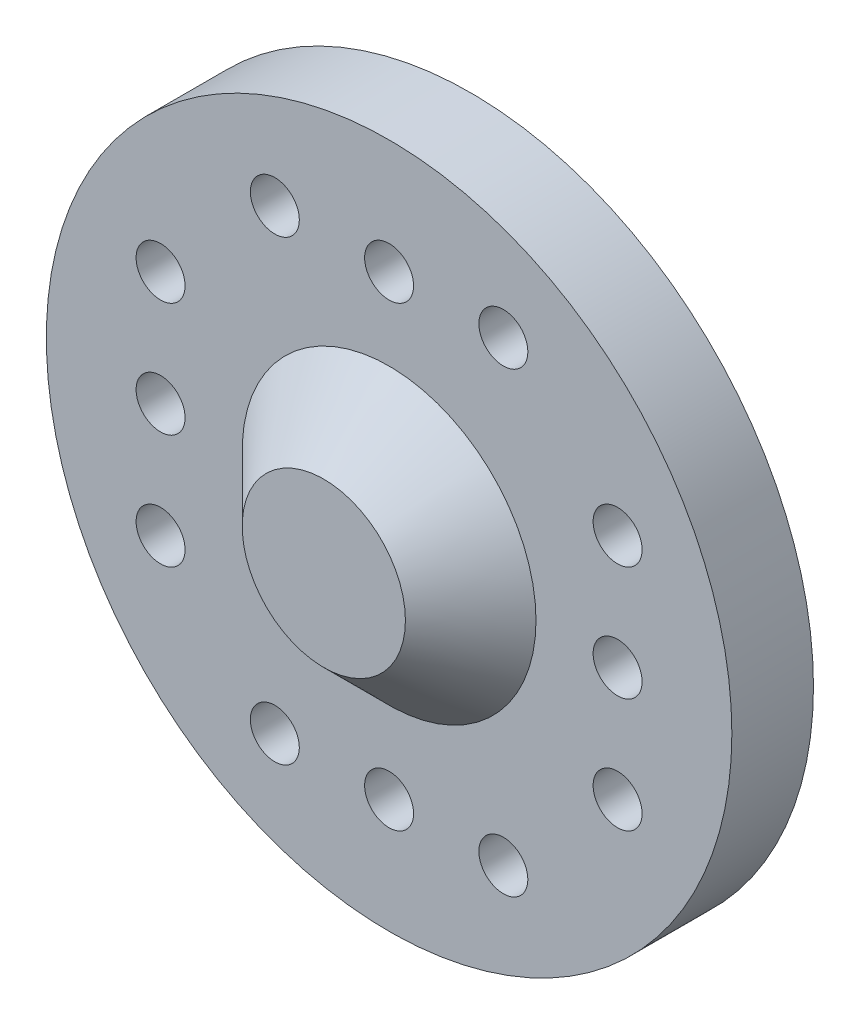
from build123d import *

# Parameters (mm, degrees)
SKETCH1_R           = 10.5
BOSS_EXTRUDE1_DEPTH = 2.5
SKETCH3_R           = 4.5
BOSS_EXTRUDE2_DEPTH = 2
CHAMFER1_SIZE       = 2
SKETCH4_R           = 0.75
CUT_EXTRUDE1_DEPTH  = 16.058220346


with BuildPart() as part:
    # Sketch1 → Boss-Extrude1 (new body)
    with BuildSketch(Plane.XY):
        Circle(SKETCH1_R)
    extrude(amount=BOSS_EXTRUDE1_DEPTH)

    # Sketch3 → Boss-Extrude2 (add)
    with BuildSketch(Plane.XY.offset(2.5)):
        Circle(SKETCH3_R)
    extrude(amount=BOSS_EXTRUDE2_DEPTH)

    # Chamfer1
    chamfer1_edges = [part.edges().sort_by_distance(p)[0] for p in [
        (-4.5, 0, 4.5),
    ]]
    chamfer(chamfer1_edges, length=CHAMFER1_SIZE - 0.0001)  # a hair under: the kernel refuses the full size

    # Sketch4 → Cut-Extrude1 (cut, through all)
    with BuildSketch(Plane.XY.offset(2.5)):
        with Locations((0, 7)):
            Circle(SKETCH4_R)
        with Locations((7, 0)):
            Circle(SKETCH4_R)
        with Locations((0, -7)):
            Circle(SKETCH4_R)
        with Locations((-7, 0)):
            Circle(SKETCH4_R)
        with Locations((3.5, 7)):
            Circle(SKETCH4_R)
        with Locations((-3.5, 7)):
            Circle(SKETCH4_R)
        with Locations((7, -3.5)):
            Circle(SKETCH4_R)
        with Locations((7, 3.5)):
            Circle(SKETCH4_R)
        with Locations((3.5, -7)):
            Circle(SKETCH4_R)
        with Locations((-3.5, -7)):
            Circle(SKETCH4_R)
        with Locations((-7, -3.5)):
            Circle(SKETCH4_R)
        with Locations((-7, 3.5)):
            Circle(SKETCH4_R)
    extrude(amount=-CUT_EXTRUDE1_DEPTH, mode=Mode.SUBTRACT)


solid = part.part
